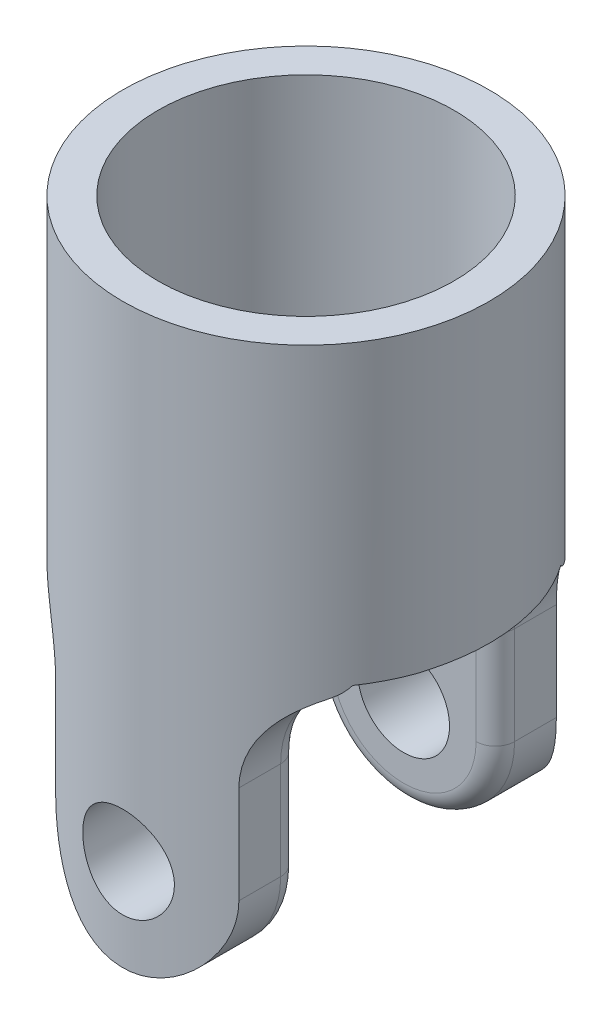
from build123d import *

# Parameters (mm, degrees)
SKETCH1_R               = 19.05
BASE_EXTRUDE_DEPTH      = 60
CUT_EXTRUDE1_DEPTH      = 66.770852207
CUT_EXTRUDE1_DEPTH_BACK = 66.770852207
CUT_EXTRUDE5_DEPTH      = 47.625
CUT_EXTRUDE5_DEPTH_BACK = 66.770852356
SKETCH8_W               = 20.32
SKETCH8_H               = 36.600526062
CUT_EXTRUDE6_DEPTH      = 66.770852356
CUT_EXTRUDE6_DEPTH_BACK = 66.770852356
SKETCH11_R              = 4.7625
FILLET6_R               = 2
SCALE1_SCALE            = 0.65
SKETCH12_R              = 10
CUT_EXTRUDE7_DEPTH      = 15


with BuildPart() as part:
    # Sketch1 → Base-Extrude (new body)
    with BuildSketch(Plane(origin=(0, 0, 0), x_dir=(-1, 0, 0), z_dir=(0, 1, 0))):
        with Locations(Location((0, 0, 0), (0, 0, 90))):
            Circle(SKETCH1_R)
    extrude(amount=BASE_EXTRUDE_DEPTH)

    # Sketch2 → Cut-Extrude1 (cut, two sides: drawn at the far end of the back side and taken through both)
    with BuildSketch(Plane.XY.offset(-CUT_EXTRUDE1_DEPTH_BACK)):
        with BuildLine():
            Line((9.525, 9.525), (9.525, 19.685))
            ThreePointArc((9.525, 19.685), (12.314807909, 26.420192091), (19.05, 29.21))
            Line((19.05, 29.21), (19.05, -1.366191125))
            Line((19.05, -1.366191125), (-19.05, -1.366191125))
            Line((-19.05, -1.366191125), (-19.05, 29.21))
            ThreePointArc((-19.05, 29.21), (-12.314807909, 26.420192091), (-9.525, 19.685))
            Line((-9.525, 19.685), (-9.525, 9.525))
            ThreePointArc((-9.525, 9.525), (0, 0), (9.525, 9.525))
        make_face()
    extrude(amount=CUT_EXTRUDE1_DEPTH + CUT_EXTRUDE1_DEPTH_BACK, mode=Mode.SUBTRACT)

    # Sketch8 → Cut-Extrude5 (cut, two sides: drawn at the far end of the back side and taken through both)
    with BuildSketch(Plane(origin=(0, 0, 0), x_dir=(0, 0, -1), z_dir=(1, 0, 0)).offset(-CUT_EXTRUDE5_DEPTH_BACK)):
        with Locations((0, 10.844975795)):
            Rectangle(SKETCH8_W, SKETCH8_H)
    extrude(amount=CUT_EXTRUDE5_DEPTH + CUT_EXTRUDE5_DEPTH_BACK, mode=Mode.SUBTRACT)

    # Sketch11 → Cut-Extrude6 (cut, two sides: drawn at the far end of the back side and taken through both)
    with BuildSketch(Plane.XY.offset(-CUT_EXTRUDE6_DEPTH_BACK)):
        with Locations(Location((0, 9.525, 0), (0, 0, 270))):
            Circle(SKETCH11_R)
    extrude(amount=CUT_EXTRUDE6_DEPTH + CUT_EXTRUDE6_DEPTH_BACK, mode=Mode.SUBTRACT)

    # Fillet6
    # the kernel refuses this fillet: 2 mm, written as the material it takes off along each edge
    with BuildSketch(Plane(origin=(19.05, 19.685, 10.16), x_dir=(-1, 0, 0), z_dir=(0, -1, 0))) as fillet6_piece_1_section:
        with BuildLine():
            CenterArc((9.525 + FILLET6_R, -FILLET6_R), FILLET6_R, 90, 90)
            Line((9.525 + FILLET6_R, 0), (9.525, 0))
            Line((9.525, 0), (9.525, -FILLET6_R))
        make_face()
    fillet6_piece_1 = revolve(axis=Axis((19.05, 19.685, 10.16), (0, 0, -1)), revolution_arc=102.134102137, mode=Mode.PRIVATE)
    fillet6_piece_1 = split(fillet6_piece_1, bisect_by=Plane(origin=(11.938855845, 29.145238826, 10.631882665), z_dir=(0, -1, 0)), keep=Keep.TOP, mode=Mode.PRIVATE)
    add(fillet6_piece_1, mode=Mode.SUBTRACT)
    with BuildSketch(Plane(origin=(9.525, 19.685, 10.16), x_dir=(0, 0, 1), z_dir=(0, -1, 0))) as fillet6_piece_2:
        with BuildLine():
            CenterArc((FILLET6_R, FILLET6_R), FILLET6_R, 180, 90)
            Line((0, FILLET6_R), (0, 0))
            Line((0, 0), (FILLET6_R, 0))
        make_face()
    extrude(amount=10.16, mode=Mode.SUBTRACT)
    with BuildSketch(Plane(origin=(0, 9.525, 10.16), x_dir=(1, 0, 0), z_dir=(0, 1, 0))) as fillet6_piece_3:
        with BuildLine():
            CenterArc((9.525 - FILLET6_R, -FILLET6_R), FILLET6_R, 0, 90)
            Line((9.525 - FILLET6_R, 0), (9.525, 0))
            Line((9.525, 0), (9.525, -FILLET6_R))
        make_face()
    revolve(axis=Axis((0, 9.525, 10.16), (0, 0, -1)), revolution_arc=180, mode=Mode.SUBTRACT)
    with BuildSketch(Plane(origin=(-9.525, 9.525, 10.16), x_dir=(1, 0, 0), z_dir=(0, 1, 0)), Plane(origin=(9.525, 9.525, -10.16), x_dir=(-1, 0, 0), z_dir=(0, 1, 0)), Plane(origin=(-9.525, 19.685, -10.16), x_dir=(1, 0, 0), z_dir=(0, -1, 0))) as fillet6_piece_4:
        with BuildLine():
            CenterArc((FILLET6_R, -FILLET6_R), FILLET6_R, 90, 90)
            Line((0, -FILLET6_R), (0, 0))
            Line((0, 0), (FILLET6_R, 0))
        make_face()
    extrude(amount=10.16, mode=Mode.SUBTRACT)
    with BuildSketch(Plane(origin=(19.05, 19.685, -10.16), x_dir=(-1, 0, 0), z_dir=(0, -1, 0))) as fillet6_piece_5_section:
        with BuildLine():
            CenterArc((9.525 + FILLET6_R, FILLET6_R), FILLET6_R, 180, 90)
            Line((9.525, FILLET6_R), (9.525, 0))
            Line((9.525, 0), (9.525 + FILLET6_R, 0))
        make_face()
    fillet6_piece_5 = revolve(axis=Axis((19.05, 19.685, -10.16), (0, 0, -1)), revolution_arc=102.134102149, mode=Mode.PRIVATE)
    fillet6_piece_5 = split(fillet6_piece_5, bisect_by=Plane(origin=(9.106524872, 29.145238826, -10.490342426), z_dir=(0, -1, 0)), keep=Keep.TOP, mode=Mode.PRIVATE)
    add(fillet6_piece_5, mode=Mode.SUBTRACT)
    with BuildSketch(Plane(origin=(0, 9.525, -10.16), x_dir=(1, 0, 0), z_dir=(0, 1, 0))) as fillet6_piece_6:
        with BuildLine():
            CenterArc((9.525 - FILLET6_R, FILLET6_R), FILLET6_R, 270, 90)
            Line((9.525, FILLET6_R), (9.525, 0))
            Line((9.525, 0), (9.525 - FILLET6_R, 0))
        make_face()
    revolve(axis=Axis((0, 9.525, -10.16), (0, 0, -1)), revolution_arc=180, mode=Mode.SUBTRACT)
    with BuildSketch(Plane(origin=(-19.05, 19.685, 10.16), x_dir=(-0.2102004972136557, 0.9776582996994051, 0), z_dir=(-0.9776582996994051, -0.2102004972136557, 0))) as fillet6_piece_7_section:
        with BuildLine():
            CenterArc((9.525 + FILLET6_R, -FILLET6_R), FILLET6_R, 90, 90)
            Line((9.525, -FILLET6_R), (9.525, 0))
            Line((9.525, 0), (9.525 + FILLET6_R, 0))
        make_face()
    fillet6_piece_7 = revolve(axis=Axis((-19.05, 19.685, 10.16), (0, 0, -1)), revolution_arc=102.134102149, mode=Mode.PRIVATE)
    fillet6_piece_7 = split(fillet6_piece_7, bisect_by=Plane(origin=(-11.937216982, 29.145238826, 10.632234159), z_dir=(0, -1, 0)), keep=Keep.TOP, mode=Mode.PRIVATE)
    add(fillet6_piece_7, mode=Mode.SUBTRACT)
    with BuildSketch(Plane(origin=(-19.05, 19.685, -10.16), x_dir=(-0.21020049700966092, 0.9776582997432648, 0), z_dir=(-0.9776582997432648, -0.21020049700966092, 0))) as fillet6_piece_8_section:
        with BuildLine():
            CenterArc((9.525 + FILLET6_R, FILLET6_R), FILLET6_R, 180, 90)
            Line((9.525, FILLET6_R), (9.525, 0))
            Line((9.525, 0), (9.525 + FILLET6_R, 0))
        make_face()
    fillet6_piece_8 = revolve(axis=Axis((-19.05, 19.685, -10.16), (0, 0, -1)), revolution_arc=102.134102137, mode=Mode.PRIVATE)
    fillet6_piece_8 = split(fillet6_piece_8, bisect_by=Plane(origin=(-11.937383184, 29.145238826, -10.632224061), z_dir=(0, -1, 0)), keep=Keep.TOP, mode=Mode.PRIVATE)
    add(fillet6_piece_8, mode=Mode.SUBTRACT)


with BuildPart() as part_1:
    # Scale1: scaled about (-5.497e-06, 39.792202177, -4.87e-07)
    add(part.part.scale(SCALE1_SCALE).moved(Location((-1.924e-06, 13.927270762, -1.7e-07))))

    # Sketch12 → Cut-Extrude7 (cut)
    with BuildSketch(Plane(origin=(0, 52.927500143, 0), x_dir=(1, 0, 0), z_dir=(0, 1, 0))):
        with Locations(Location((0, 0, 0), (0, 0, 270))):
            Circle(SKETCH12_R)
    extrude(amount=-CUT_EXTRUDE7_DEPTH, mode=Mode.SUBTRACT)


solid = part_1.part
